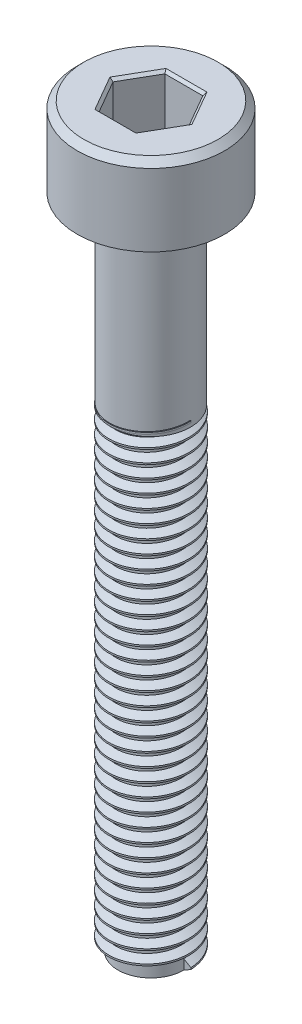
from build123d import *

# Parameters (mm, degrees)
SKETCH1_R           = 1.5
BOSS_EXTRUDE1_DEPTH = 7
SKETCH2_R           = 1.25
BOSS_EXTRUDE2_DEPTH = 18
THREAD1_PITCH       = 0.5
SKETCH5_R           = 2.8
BOSS_EXTRUDE3_DEPTH = 3
CUT_EXTRUDE1_DEPTH  = 2
CHAMFER1_SIZE       = 0.1
CHAMFER2_SIZE       = 0.25


with BuildPart() as part:
    # Sketch1 → Boss-Extrude1 (new body)
    with BuildSketch(Plane(origin=(0, 0, 0), x_dir=(1, 0, 0), z_dir=(0, 1, 0))):
        with Locations(Location((0, 0, 0), (0, 0, 270))):
            Circle(SKETCH1_R)
    extrude(amount=-BOSS_EXTRUDE1_DEPTH)

    # Sketch2 → Boss-Extrude2 (add)
    with BuildSketch(Plane.XZ.offset(7)):
        with Locations(Location((0, 0, 0), (0, 0, 270))):
            Circle(SKETCH2_R)
    extrude(amount=BOSS_EXTRUDE2_DEPTH)

    # Thread1: the profile of Thread Profile1 profile screwed along a right-hand helix of 36 turns, 6 arcs to a turn; built about Z, then put on its axis
    thread1_z = Axis((0, 0, 0), (0, 0, 1))
    thread1_corners = [(1.2497, 0, -0.000173205), (1.520632938, 0, 0.156249999), (1.520632937, 0, 0.218749999), (1.2497, 0, 0.375173204)]
    with BuildLine(mode=Mode.PRIVATE) as thread1_profile:
        Line(thread1_corners[0], thread1_corners[1])
        Line(thread1_corners[1], thread1_corners[2])
        Line(thread1_corners[2], thread1_corners[3])
        Line(thread1_corners[3], thread1_corners[0])
    thread1_cap = Face(thread1_profile.wire())
    thread1_turn_angles = [0, 30, 60, 90, 120, 150, 180, 210, 240, 270, 300, 330, 360]
    thread1_turn_weights = [1, 0.8660254037844387, 1, 0.8660254037844387, 1, 0.8660254037844387, 1, 0.8660254037844387, 1, 0.8660254037844387, 1, 0.8660254037844387, 1]
    thread1_turn_rails = [Edge.make_bspline([Vector(p[0], p[1], 0).rotate(thread1_z, thread1_turn_angles[k]) / thread1_turn_weights[k] + Vector(0, 0, p[2] + THREAD1_PITCH * thread1_turn_angles[k] / 360) for k in range(13)], [0, 0, 0, 1, 1, 2, 2, 3, 3, 4, 4, 5, 5, 6, 6, 6], 2, thread1_turn_weights) for p in thread1_corners]
    thread1_turn_sides = [Face.make_surface_from_curves(thread1_turn_rails[p[0]], thread1_turn_rails[p[1]]) for p in [(0, 1), (1, 2), (2, 3), (3, 0)]]
    thread1 = Plane(origin=(0, -25, 0), x_dir=(1, 0, 0), z_dir=(0, 1, 0)) * Solid(Shell([*[p.moved(Location((0, 0, THREAD1_PITCH * i))) for i in range(36) for p in thread1_turn_sides], thread1_cap, thread1_cap.rotate(thread1_z, 12960).moved(Location((0, 0, THREAD1_PITCH * 12960 / 360)))]))
    add(thread1)

    # Sketch5 → Boss-Extrude3 (add)
    with BuildSketch(Plane(origin=(0, 0, 0), x_dir=(1, 0, 0), z_dir=(0, 1, 0))):
        with Locations(Location((0, 0, 0), (0, 0, 270))):
            Circle(SKETCH5_R)
    extrude(amount=BOSS_EXTRUDE3_DEPTH)

    # Sketch6 → Cut-Extrude1 (cut)
    with BuildSketch(Plane(origin=(0, 3, 0), x_dir=(1, 0, 0), z_dir=(0, 1, 0))):
        Polygon((1.443375673, 0), (0.721687836, 1.25), (-0.721687836, 1.25), (-1.443375673, 0), (-0.721687836, -1.25), (0.721687836, -1.25), align=None)
    extrude(amount=-CUT_EXTRUDE1_DEPTH, mode=Mode.SUBTRACT)

    # Chamfer1
    chamfer1_edges = [part.edges().sort_by_distance(p)[0] for p in [
        (1.082531755, 3, 0.625),
        (1.082531755, 3, -0.625),
        (0, 3, -1.25),
        (-1.082531755, 3, -0.625),
        (-1.082531755, 3, 0.625),
        (0, 3, 1.25),
    ]]
    chamfer(chamfer1_edges, length=CHAMFER1_SIZE)

    # Chamfer2
    chamfer2_edges = [part.edges().sort_by_distance(p)[0] for p in [
        (0, 3, -2.8),
    ]]
    chamfer(chamfer2_edges, length=CHAMFER2_SIZE)


solid = part.part
